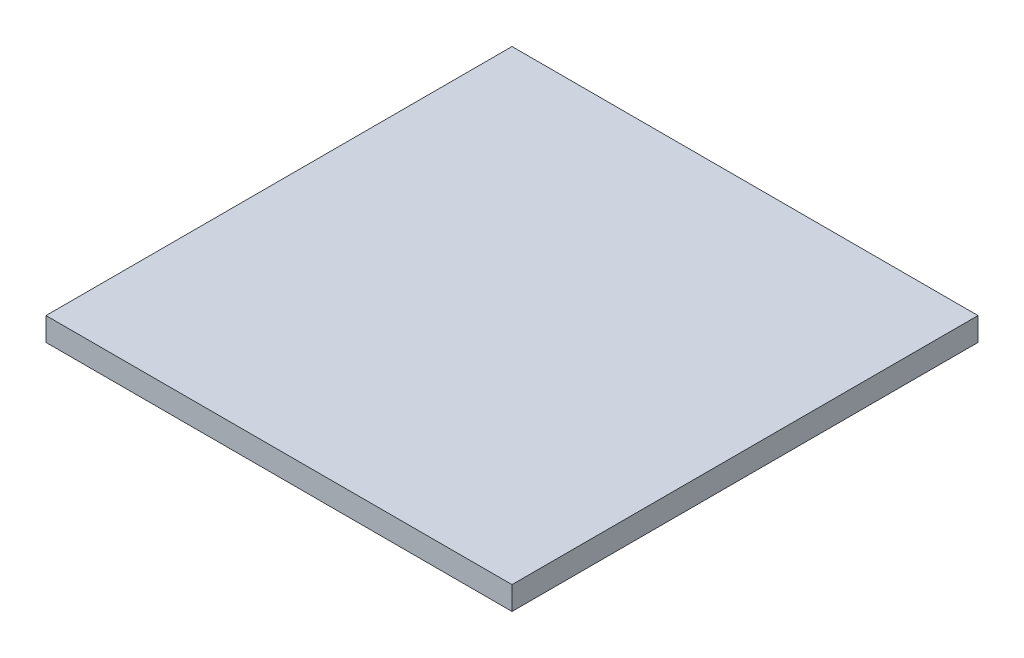
from build123d import *

# Parameters (mm, degrees)
BOSS_EXTRUDE1_DEPTH       = 5
BOSS_EXTRUDE1_DEPTH_BACK  = 95
SKETCH1_W                 = 2000
SKETCH1_H                 = 2000
BODY_MOVE_COPY1_START     = -1000
BODY_MOVE_COPY1_OUTLINE_W = 100
BODY_MOVE_COPY1_OUTLINE_H = 2000
BODY_MOVE_COPY1_DEPTH     = 2000


# Read off the part's stored shape, not the designer's step: Body-Move/Copy1
with BuildPart() as part:
    # Sketch1 → Boss-Extrude1 (new, two sides: drawn at the far end of the back side and taken through both)
    with BuildSketch(Plane(origin=(0, 0, 0), x_dir=(1, 0, 0), z_dir=(0, 1, 0)).offset(-BOSS_EXTRUDE1_DEPTH_BACK)):
        Rectangle(SKETCH1_W, SKETCH1_H)
    extrude(amount=BOSS_EXTRUDE1_DEPTH + BOSS_EXTRUDE1_DEPTH_BACK)


with BuildPart() as body_2:
    # Body-Move/Copy1 outline → Body-Move/Copy1 (new body)
    with BuildSketch(Plane.YZ.offset(BODY_MOVE_COPY1_START)):
        with Locations((-45, 0)):
            Rectangle(BODY_MOVE_COPY1_OUTLINE_W, BODY_MOVE_COPY1_OUTLINE_H)
    extrude(amount=BODY_MOVE_COPY1_DEPTH)


solid = Compound([part.part, body_2.part])
